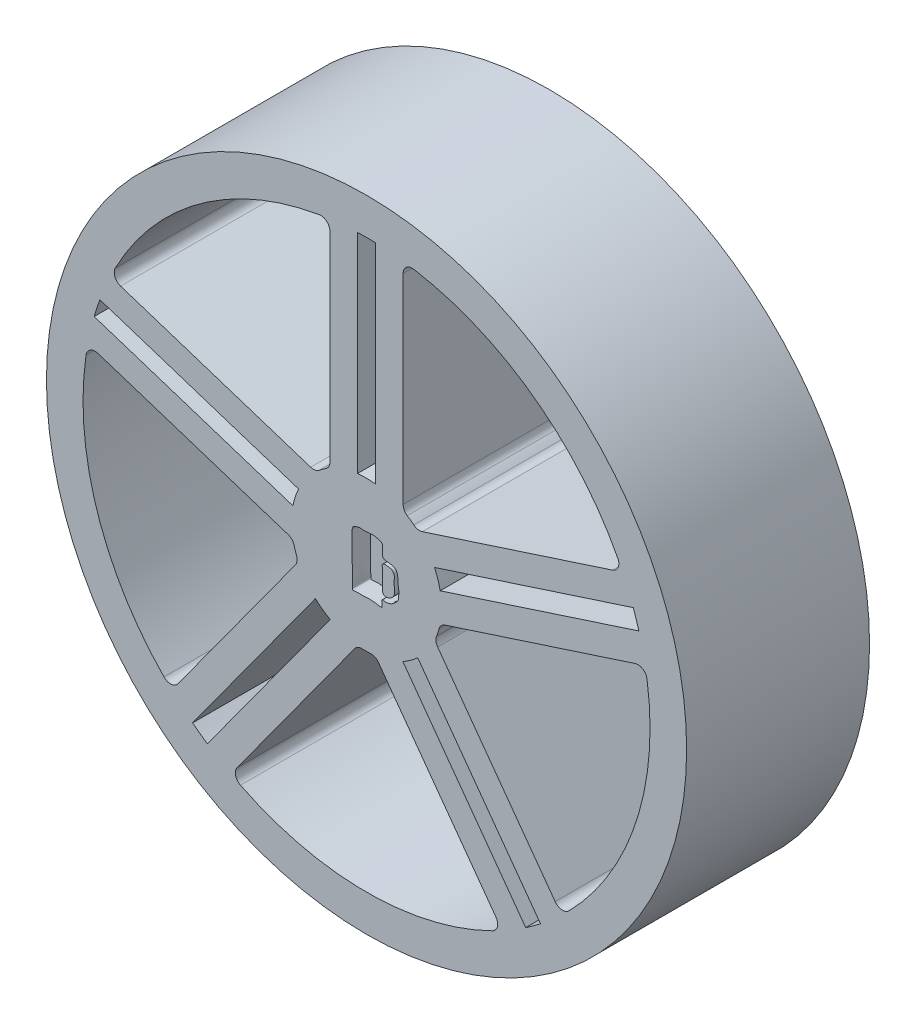
from build123d import *

# Parameters (mm, degrees)
ESQUISSE1_R                  = 4.1
ESQUISSE1_R_2                = 2.1
BOSS_EXTRU_1_DEPTH           = 6
ESQUISSE2_R                  = 17.5
BOSS_EXTRU_3_DEPTH           = 10
CONG_5_R                     = 0.5
R_P_TITION_CIRCULAIRE2_COUNT = 5
CONG_6_R                     = 0.5
ENL_V_MAT_EXTRU_1_DEPTH      = 1


with BuildPart() as part:
    # Esquisse1 → Boss.-Extru.1 (new body)
    with BuildSketch(Plane.XY):
        Circle(ESQUISSE1_R)
        Circle(ESQUISSE1_R_2, mode=Mode.SUBTRACT)
    extrude(amount=BOSS_EXTRU_1_DEPTH)

    # Esquisse2 → Boss.-Extru.3 (add)
    with BuildSketch(Plane.XY.offset(6)):
        Circle(ESQUISSE2_R)
        with BuildLine():
            Line((2, 3.579106034), (2, 15.370426149))
            ThreePointArc((2, 15.370426149), (0, -15.5), (-2, 15.370426149))
            Line((-2, 15.370426149), (-2, 3.579106034))
            ThreePointArc((-2, 3.579106034), (0, -4.1), (2, 3.579106034))
        make_face(mode=Mode.SUBTRACT)
        with BuildLine():
            Line((-0.5, 4.06939799), (-0.5, 15.491933385))
            ThreePointArc((-0.5, 15.491933385), (0, 15.5), (0.5, 15.491933385))
            Line((0.5, 15.491933385), (0.5, 4.06939799))
            ThreePointArc((0.5, 4.06939799), (0, 4.1), (-0.5, 4.06939799))
        make_face(mode=Mode.SUBTRACT)
    boss_extru_3 = extrude(amount=BOSS_EXTRU_3_DEPTH)

    # Congé5
    # the kernel refuses this fillet: 0.5 mm, written as the material it adds along each edge
    with BuildSketch(Plane(origin=(2, 3.579106034, 6), x_dir=(0.856640365534706, -0.5159140278540265, 0), z_dir=(0, 0, 1))) as cong_5_piece_1:
        with BuildLine():
            CenterArc((0.282708153, 0.499735946), CONG_5_R, 211.058569469, 57.079265472)
            Line((-0.14561203, 0.241778932), (0, 0))
            ThreePointArc((0, 0), (0.133230279, 0.002165243), (0.266460558, 0))
        make_face()
    extrude(amount=10)
    with BuildSketch(Plane(origin=(2, 15.370426149, 6), x_dir=(0, -1, 0), z_dir=(0, 0, 1))) as cong_5_piece_2:
        with BuildLine():
            CenterArc((0.580226691, 0.5), CONG_5_R, 170.405931773, 99.594068227)
            ThreePointArc((0.087220043, 0.583333333), (0.040835089, 0.292081575), (0, 0))
            Line((0, 0), (0.580226691, 0))
        make_face()
    extrude(amount=10)
    with BuildSketch(Plane(origin=(-2, 15.370426149, 6), x_dir=(0, -1, 0), z_dir=(0, 0, 1))) as cong_5_piece_3:
        with BuildLine():
            CenterArc((0.580226691, -0.5), CONG_5_R, 90, 99.594068227)
            ThreePointArc((0.087220043, -0.583333333), (0.040835089, -0.292081575), (0, 0))
            Line((0, 0), (0.580226691, 0))
        make_face()
    extrude(amount=10)
    with BuildSketch(Plane(origin=(-2, 3.579106034, 6), x_dir=(-0.8566403655347238, -0.515914027853997, 0), z_dir=(0, 0, 1))) as cong_5_piece_4:
        with BuildLine():
            CenterArc((0.282708153, -0.499735946), CONG_5_R, 91.862165059, 57.079265472)
            Line((-0.14561203, -0.241778932), (0, 0))
            ThreePointArc((0, 0), (0.133230279, -0.002165243), (0.266460558, 0))
        make_face()
    extrude(amount=10)

    # Répétition circulaire2: Boss.-Extru.3 ×5 about axis
    r_p_tition_circulaire2_axis = Axis((0, 0, 0), (0, 0, 1))
    for i in range(1, R_P_TITION_CIRCULAIRE2_COUNT):
        add(boss_extru_3.rotate(r_p_tition_circulaire2_axis, i * 360 / R_P_TITION_CIRCULAIRE2_COUNT))

    # Congé6
    # the kernel refuses this fillet: 0.5 mm, written as the material it adds along each edge
    with BuildSketch(Plane(origin=(-14.000109958, 6.651835923, 6), x_dir=(0.95105651629517, -0.3090169943748974, 0), z_dir=(0, 0, 1)), Plane(origin=(-10.652543801, -11.259365461, 6), x_dir=(0.5877852522924284, 0.8090169943749799, 0), z_dir=(0, 0, 1)), Plane(origin=(7.416475823, -13.61050647, 6), x_dir=(-0.5877852522925181, 0.8090169943749146, 0), z_dir=(0, 0, 1)), Plane(origin=(15.236177936, 2.847609858, 6), x_dir=(-0.9510565162951373, -0.30901699437499736, 0), z_dir=(0, 0, 1))) as cong_6_piece_1:
        with BuildLine():
            CenterArc((0.580226691, 0.5), CONG_6_R, 170.405931773, 99.594068227)
            ThreePointArc((0.087220043, 0.583333333), (0.040835089, 0.292081575), (0, 0))
            Line((0, 0), (0.580226691, 0))
        make_face()
    extrude(amount=10)
    with BuildSketch(Plane(origin=(-4.021966105, -0.796108444, 6), x_dir=(-0.9510565162951476, 0.30901699437496566, 0), z_dir=(0, 0, 1)), Plane(origin=(-0.485711754, -4.07112811, 6), x_dir=(-0.587785252292492, -0.8090169943749336, 0), z_dir=(0, 0, 1)), Plane(origin=(2.785898127, 3.008117622, 6), x_dir=(0.95105651629516, 0.30901699437492763, 0), z_dir=(0, 0, 1)), Plane(origin=(3.721779732, -1.719987101, 6), x_dir=(0.5877852522924618, -0.8090169943749556, 0), z_dir=(0, 0, 1))) as cong_6_piece_2:
        with BuildLine():
            CenterArc((0.282240882, 0.5), CONG_6_R, 212.920734528, 57.079265472)
            ThreePointArc((-0.13747074, 0.22826087), (-0.066880535, 0.115247514), (0, 0))
            Line((0, 0), (0.282240882, 0))
        make_face()
    extrude(amount=10)
    with BuildSketch(Plane(origin=(-2.785898127, 3.008117622, 6), x_dir=(-0.9510565162951584, 0.30901699437493263, 0), z_dir=(0, 0, 1)), Plane(origin=(0.485711754, -4.07112811, 6), x_dir=(0.5877852522924834, -0.80901699437494, 0), z_dir=(0, 0, 1)), Plane(origin=(4.021966105, -0.796108444, 6), x_dir=(0.9510565162951494, 0.3090169943749601, 0), z_dir=(0, 0, 1)), Plane(origin=(-3.721779732, -1.719987101, 6), x_dir=(-0.5877852522924625, -0.8090169943749551, 0), z_dir=(0, 0, 1))) as cong_6_piece_3:
        with BuildLine():
            CenterArc((0.282240882, -0.5), CONG_6_R, 90, 57.079265472)
            ThreePointArc((-0.13747074, -0.22826087), (-0.066880535, -0.115247514), (0, 0))
            Line((0, 0), (0.282240882, 0))
        make_face()
    extrude(amount=10)
    with BuildSketch(Plane(origin=(-15.236177936, 2.847609858, 6), x_dir=(0.9510565162950345, -0.3090169943753136, 0), z_dir=(0, 0, 1)), Plane(origin=(10.652543801, -11.259365461, 6), x_dir=(-0.5877852522921582, 0.8090169943751762, 0), z_dir=(0, 0, 1)), Plane(origin=(14.000109958, 6.651835923, 6), x_dir=(-0.9510565162952725, -0.30901699437458163, 0), z_dir=(0, 0, 1)), Plane(origin=(-7.416475823, -13.61050647, 6), x_dir=(0.5877852522927831, 0.8090169943747222, 0), z_dir=(0, 0, 1))) as cong_6_piece_4:
        with BuildLine():
            CenterArc((0.580226691, -0.5), CONG_6_R, 90, 99.594068227)
            ThreePointArc((0.087220043, -0.583333333), (0.040835089, -0.292081575), (0, 0))
            Line((0, 0), (0.580226691, 0))
        make_face()
    extrude(amount=10)

    # Esquisse3 → Enlèv. mat.-Extru.1 (cut)
    with BuildSketch(Plane.XY.offset(16)):
        with BuildLine():
            add(Edge.make_bspline(
                [(-0.781170014, 1.304004922), (-0.812563749, 1.155777067), (-0.779234347, 0.872861941), (-0.789120429, 0.435915264), (-0.779662215, 0.00403459), (-0.779566847, -0.436819947), (-0.790669805, -0.918125792), (-0.753886654, -1.254210502), (-0.812960802, -1.619629404), (-0.46848935, -1.526718543), (-0.210313129, -1.578712073), (0.206570231, -1.5215438), (0.483914566, -1.560659915), (0.894295895, -1.634559216), (0.820350644, -1.445502947), (0.844042185, -1.343660096), (0.813162572, -1.228475349), (0.936068838, -1.201220794), (1.049263647, -1.264408958), (1.196472414, -1.2143847), (1.354127977, -1.188939762), (1.48225229, -1.070899097), (1.630678619, -0.966920839), (1.756146104, -0.797993424), (1.747587013, -0.600658443), (1.793539651, -0.36734293), (1.705261694, -0.110947754), (1.73453965, 0.133450986), (1.698978601, 0.317241234), (1.675274487, 0.468699178), (1.567690497, 0.618342491), (1.350417168, 0.686766032), (1.143639018, 0.720499311), (0.9428535, 0.726655294), (0.85099379, 0.889975418), (0.8925264, 1.042820703), (0.861289404, 1.219750047), (0.912836482, 1.378714894), (0.792663409, 1.491607795), (0.638917577, 1.531180573), (0.440629112, 1.60203452), (0.20858732, 1.575087697), (-0.002645656, 1.564249374), (-0.193646565, 1.537998466), (-0.373102838, 1.592366964), (-0.539764419, 1.520975183), (-0.725989147, 1.491167171), (-0.768937119, 1.361763444), (-0.781170014, 1.304004922)],
                knots=[0, 0, 0, 0, 0.041401656, 0.082967656, 0.124831503, 0.16541839, 0.210270414, 0.259846062, 0.271899371, 0.299274831, 0.326037955, 0.357720778, 0.410942043, 0.427867114, 0.442662916, 0.451602915, 0.460542914, 0.470438204, 0.478266215, 0.497739299, 0.510942132, 0.523848972, 0.546138408, 0.563929013, 0.580743748, 0.601196424, 0.631542095, 0.655672873, 0.670757522, 0.685175475, 0.6992867, 0.721042554, 0.74732753, 0.762106015, 0.773798503, 0.795128896, 0.805353228, 0.825589214, 0.836672952, 0.847964087, 0.871314939, 0.896055832, 0.913792222, 0.932301035, 0.951146153, 0.96451384, 0.983867415, 1, 1, 1, 1], degree=3))
        make_face()
        with BuildLine():
            add(Edge.make_bspline(
                [(0.862853166, 0.319880005), (0.875242371, 0.203602803), (0.851846633, 0.015426685), (0.870814127, -0.293915634), (0.894410845, -0.55366391), (0.8562846, -0.775313723), (0.917218147, -1.002213112), (1.157109792, -0.996086818), (1.324288904, -0.917035516), (1.471649561, -0.796046729), (1.531405346, -0.606499314), (1.539582323, -0.393876838), (1.503758708, -0.19142601), (1.496156029, 0.000367913), (1.557995818, 0.217865985), (1.433984078, 0.472846391), (1.176337864, 0.505805782), (1.012207317, 0.545102616), (0.839476839, 0.465569349), (0.857164259, 0.373272475), (0.862853166, 0.319880005)],
                knots=[0, 0, 0, 0, 0.083463664, 0.157840166, 0.239391453, 0.285079185, 0.338278506, 0.392619199, 0.441520026, 0.487125232, 0.535865276, 0.591595143, 0.65293684, 0.696801833, 0.739973989, 0.83015049, 0.868591678, 0.937864877, 0.961674936, 1, 1, 1, 1], degree=3))
        make_face(mode=Mode.SUBTRACT)
    extrude(amount=-ENL_V_MAT_EXTRU_1_DEPTH, mode=Mode.SUBTRACT)


solid = part.part
